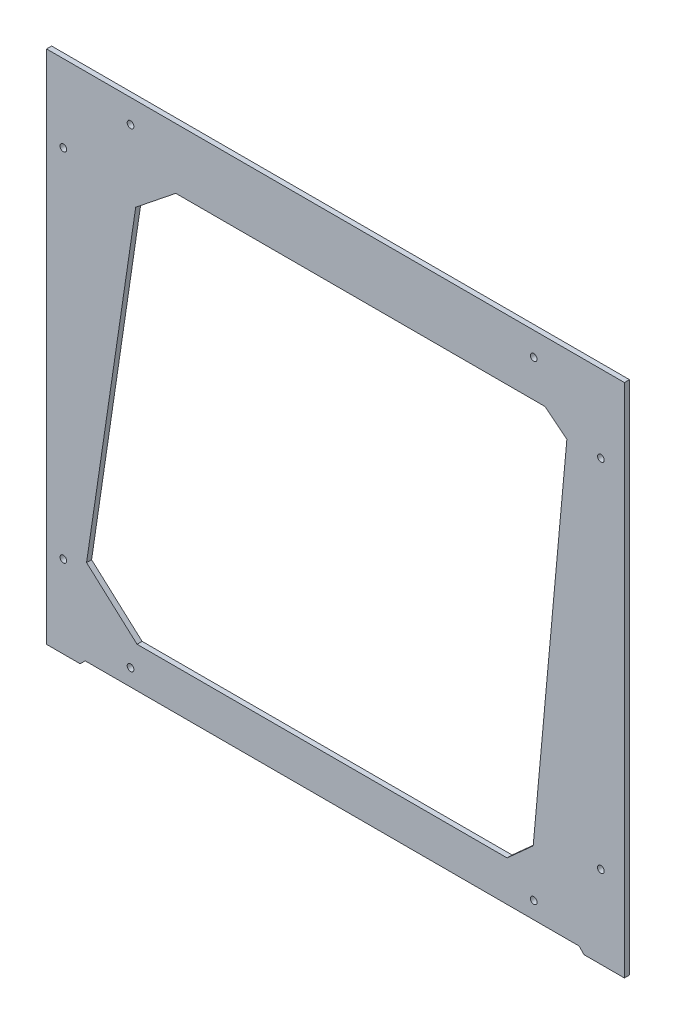
from build123d import *

# Parameters (mm, degrees)
SKETCH1_R           = 2
BOSS_EXTRUDE1_DEPTH = 3


with BuildPart() as part:
    # Sketch1 → Boss-Extrude1 (new body)
    with BuildSketch(Plane.XY):
        Polygon((-147, -152), (147, -152), (150, -155), (174, -155), (174, 152), (-170, 152), (-170, -155), (-150, -155), align=None)
        with Locations((-160, -106)):
            Circle(SKETCH1_R, mode=Mode.SUBTRACT)
        with Locations((-120, -142)):
            Circle(SKETCH1_R, mode=Mode.SUBTRACT)
        with Locations((120, -142)):
            Circle(SKETCH1_R, mode=Mode.SUBTRACT)
        with Locations((160, -106)):
            Circle(SKETCH1_R, mode=Mode.SUBTRACT)
        Polygon((139.743742132, 105.556883277), (119.695267465, -114.021648782), (104.163766112, -128), (-116.122543043, -128), (-146.186316956, -100.942603479), (-116.938889079, 96.907643922), (-93.073443982, 116), (126.689846228, 116), align=None, mode=Mode.SUBTRACT)
        with Locations((-160, 106)):
            Circle(SKETCH1_R, mode=Mode.SUBTRACT)
        with Locations((-120, 138)):
            Circle(SKETCH1_R, mode=Mode.SUBTRACT)
        with Locations((160, 106)):
            Circle(SKETCH1_R, mode=Mode.SUBTRACT)
        with Locations((120, 138)):
            Circle(SKETCH1_R, mode=Mode.SUBTRACT)
    extrude(amount=BOSS_EXTRUDE1_DEPTH)


solid = part.part
